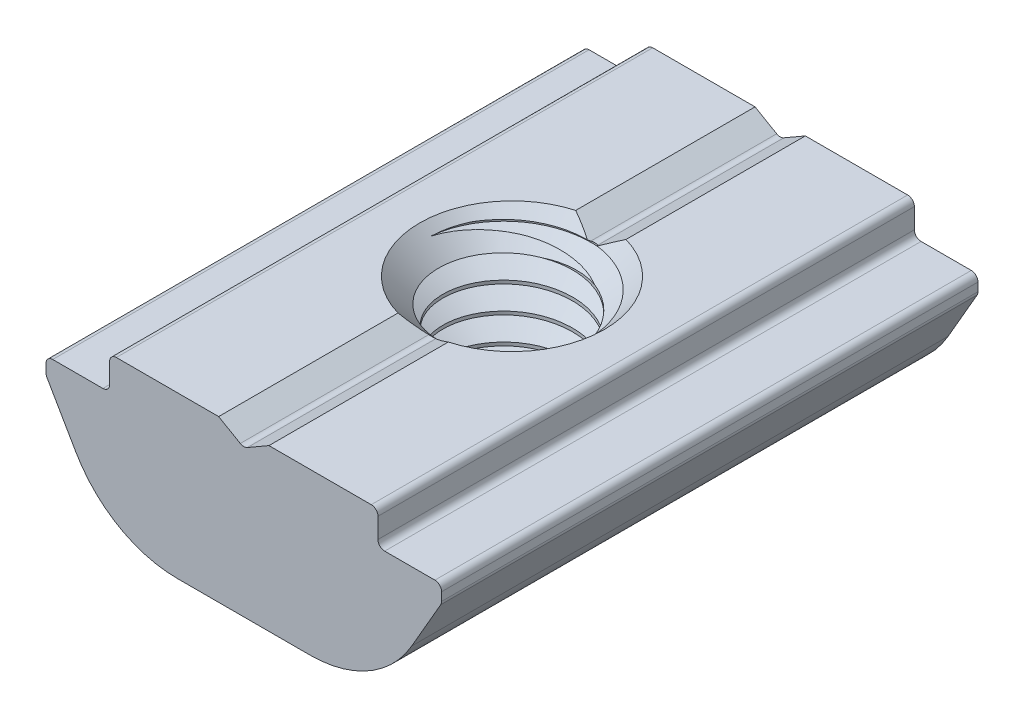
from build123d import *

# Parameters (mm, degrees)
BOSS_EXTRUDE1_DEPTH          = 8
BOSS_EXTRUDE1_DEPTH_BACK     = 8
SKETCH4_R                    = 2.5
CUT_EXTRUDE1_DEPTH           = 12.038568748
SWEEP1_PITCH                 = 0.8
SKETCH9_R                    = 2.754
CUT_EXTRUDE4_OTHER_WAY_DEPTH = 12.409291943
SKETCH10_R                   = 3.135
CUT_EXTRUDE5_OTHER_WAY_DEPTH = 12.038568864
CUT_EXTRUDE6_DEPTH           = 18.221207962


with BuildPart() as part:
    # Sketch3 → Boss-Extrude1 (new, two sides: drawn at the far end of the back side and taken through both)
    with BuildSketch(Plane.XY.offset(-BOSS_EXTRUDE1_DEPTH_BACK)):
        with BuildLine():
            Line((3.802, 2.4), (0.75, 2.4))
            Line((0.75, 2.4), (0.105, 2.027609076))
            ThreePointArc((0.105, 2.027609076), (0, 1.999474411), (-0.105, 2.027609076))
            Line((-0.105, 2.027609076), (-0.75, 2.4))
            Line((-0.75, 2.4), (-3.802, 2.4))
            ThreePointArc((-3.802, 2.4), (-3.943421356, 2.341421356), (-4.002, 2.2))
            Line((-4.002, 2.2), (-4.002, 1.6))
            ThreePointArc((-4.002, 1.6), (-4.060578644, 1.458578644), (-4.202, 1.4))
            Line((-4.202, 1.4), (-5.7, 1.4))
            ThreePointArc((-5.7, 1.4), (-5.841421356, 1.341421356), (-5.9, 1.2))
            Line((-5.9, 1.2), (-5.9, 0.95))
            ThreePointArc((-5.9, 0.95), (-5.893185165, 0.898236191), (-5.873205081, 0.85))
            Line((-5.873205081, 0.85), (-5.007179677, -0.65))
            ThreePointArc((-5.007179677, -0.65), (-3.726090764, -1.931088913), (-1.976090764, -2.4))
            Line((-1.976090764, -2.4), (1.976090764, -2.4))
            ThreePointArc((1.976090764, -2.4), (3.726090764, -1.931088913), (5.007179677, -0.65))
            Line((5.007179677, -0.65), (5.873205081, 0.85))
            ThreePointArc((5.873205081, 0.85), (5.893185165, 0.898236191), (5.9, 0.95))
            Line((5.9, 0.95), (5.9, 1.2))
            ThreePointArc((5.9, 1.2), (5.841421356, 1.341421356), (5.7, 1.4))
            Line((5.7, 1.4), (4.202, 1.4))
            ThreePointArc((4.202, 1.4), (4.060578644, 1.458578644), (4.002, 1.6))
            Line((4.002, 1.6), (4.002, 2.2))
            ThreePointArc((4.002, 2.2), (3.943421356, 2.341421356), (3.802, 2.4))
        make_face()
    extrude(amount=BOSS_EXTRUDE1_DEPTH + BOSS_EXTRUDE1_DEPTH_BACK)

    # Sketch4 → Cut-Extrude1 (cut, through all)
    with BuildSketch(Plane(origin=(0, 2.4, 0), x_dir=(1, 0, 0), z_dir=(0, 1, 0))):
        with Locations(Location((0, 0, 0), (0, 0, 272.40713079))):
            Circle(SKETCH4_R)
    extrude(amount=-CUT_EXTRUDE1_DEPTH, mode=Mode.SUBTRACT)

    # Cut-Extrude2 cone 1 section (through the dimple's axis) → Cut-Extrude2 (revolve, cut)
    with BuildSketch(Plane(origin=(0, 2.4, 0), x_dir=(0, 0, 1), z_dir=(1, 0, 0))):
        Polygon((0, 0), (2.754, 0), (0, 2.754), align=None)
    revolve(axis=Axis((0, 2.4, 0), (0, -1, 0)), mode=Mode.SUBTRACT)

    # Cut-Extrude3 cone 1 section (through the dimple's axis) → Cut-Extrude3 (revolve, cut)
    with BuildSketch(Plane(origin=(0, -2.4, 0), x_dir=(0, 0, -1), z_dir=(1, 0, 0))):
        Polygon((0, 0), (3.135, 0), (0, 3.135), align=None)
    revolve(axis=Axis((0, -2.4, 0), (0, 1, 0)), mode=Mode.SUBTRACT)

    # Sweep1: the profile of Sketch8 profile screwed along a right-hand helix of 7 turns, 8 arcs to a turn; built about Z, then put on its axis
    sweep1_z = Axis((0, 0, 0), (0, 0, 1))
    sweep1_corners = [(1.937083488, 0, -0.325), (1.937083488, 0, -0.425), (2.5003, 0, -0.750173205), (2.5003, 0, 0.000173205)]
    with BuildLine(mode=Mode.PRIVATE) as sweep1_profile:
        Line(sweep1_corners[0], sweep1_corners[1])
        Line(sweep1_corners[1], sweep1_corners[2])
        Line(sweep1_corners[2], sweep1_corners[3])
        Line(sweep1_corners[3], sweep1_corners[0])
    sweep1_cap = Face(sweep1_profile.wire())
    sweep1_turn_angles = [0, 22.5, 45, 67.5, 90, 112.5, 135, 157.5, 180, 202.5, 225, 247.5, 270, 292.5, 315, 337.5, 360]
    sweep1_turn_weights = [1, 0.9238795325112867, 1, 0.9238795325112867, 1, 0.9238795325112867, 1, 0.9238795325112867, 1, 0.9238795325112867, 1, 0.9238795325112867, 1, 0.9238795325112867, 1, 0.9238795325112867, 1]
    sweep1_turn_rails = [Edge.make_bspline([Vector(p[0], p[1], 0).rotate(sweep1_z, sweep1_turn_angles[k]) / sweep1_turn_weights[k] + Vector(0, 0, p[2] + SWEEP1_PITCH * sweep1_turn_angles[k] / 360) for k in range(17)], [0, 0, 0, 1, 1, 2, 2, 3, 3, 4, 4, 5, 5, 6, 6, 7, 7, 8, 8, 8], 2, sweep1_turn_weights) for p in sweep1_corners]
    sweep1_turn_sides = [Face.make_surface_from_curves(sweep1_turn_rails[p[0]], sweep1_turn_rails[p[1]]) for p in [(0, 1), (1, 2), (2, 3), (3, 0)]]
    sweep1 = Plane(origin=(0, 2.4, 0), x_dir=(0, 0, 1), z_dir=(0, -1, 0)) * Solid(Shell([*[p.moved(Location((0, 0, SWEEP1_PITCH * i))) for i in range(7) for p in sweep1_turn_sides], sweep1_cap, sweep1_cap.rotate(sweep1_z, 2520).moved(Location((0, 0, SWEEP1_PITCH * 2520 / 360)))]))
    add(sweep1)

    # Cut-Extrude4 cone 1 section (through the dimple's axis) → Cut-Extrude4 (revolve, cut)
    with BuildSketch(Plane(origin=(0, 2.4, 0), x_dir=(0, 0, 1), z_dir=(1, 0, 0))):
        Polygon((0, 0), (2.754, 0), (0, 2.754), align=None)
    revolve(axis=Axis((0, 2.4, 0), (0, -1, 0)), mode=Mode.SUBTRACT)

    # Sketch9 → Cut-Extrude4 other way (cut)
    with BuildSketch(Plane(origin=(0, 2.4, 0), x_dir=(1, 0, 0), z_dir=(0, 1, 0))):
        Circle(SKETCH9_R)
    extrude(amount=CUT_EXTRUDE4_OTHER_WAY_DEPTH, mode=Mode.SUBTRACT)

    # Cut-Extrude5 cone 1 section (through the dimple's axis) → Cut-Extrude5 (revolve, cut)
    with BuildSketch(Plane(origin=(0, -2.4, 0), x_dir=(0, 0, -1), z_dir=(1, 0, 0))):
        Polygon((0, 0), (3.135, 0), (0, 3.135), align=None)
    revolve(axis=Axis((0, -2.4, 0), (0, 1, 0)), mode=Mode.SUBTRACT)

    # Sketch10 → Cut-Extrude5 other way (cut)
    with BuildSketch(Plane.XZ.offset(2.4)):
        Circle(SKETCH10_R)
    extrude(amount=CUT_EXTRUDE5_OTHER_WAY_DEPTH, mode=Mode.SUBTRACT)

    # Sketch11 → Cut-Extrude6 (cut, through all)
    with BuildSketch(Plane.XY.offset(8)):
        with BuildLine():
            Line((0.75, 2.4), (0.105, 2.027609076))
            ThreePointArc((0.105, 2.027609076), (0, 1.999474411), (-0.105, 2.027609076))
            Line((-0.105, 2.027609076), (-0.75, 2.4))
            Line((-0.75, 2.4), (0.75, 2.4))
        make_face()
    extrude(amount=-CUT_EXTRUDE6_DEPTH, mode=Mode.SUBTRACT)


solid = part.part
